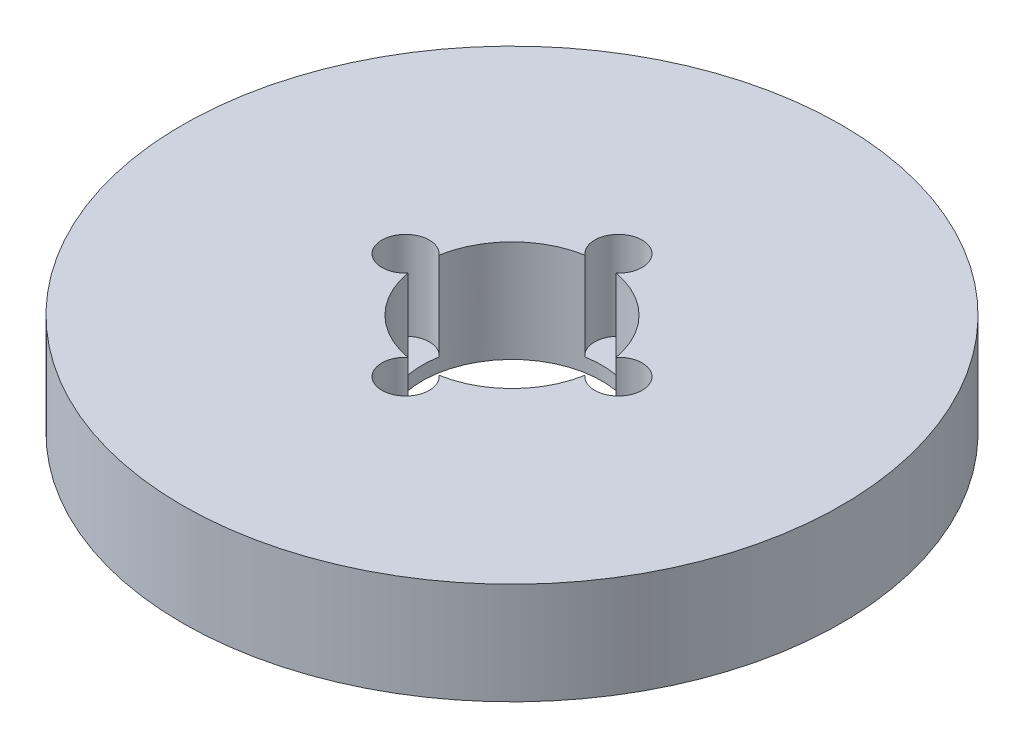
from build123d import *

# Parameters (mm, degrees)
SKETCH1_R           = 55
BOSS_EXTRUDE1_DEPTH = 17
SKETCH2_R           = 15
CUT_EXTRUDE1_DEPTH  = 80.617837197
SKETCH3_R           = 3.964920539
CUT_EXTRUDE2_DEPTH  = 14.720649074
CIRPATTERN1_COUNT   = 4


with BuildPart() as part:
    # Sketch1 → Boss-Extrude1 (new body)
    with BuildSketch(Plane(origin=(0, 0, 0), x_dir=(1, 0, 0), z_dir=(0, 1, 0))):
        Circle(SKETCH1_R)
    extrude(amount=BOSS_EXTRUDE1_DEPTH)

    # Sketch2 → Cut-Extrude1 (cut, through all)
    with BuildSketch(Plane(origin=(0, 0, 0), x_dir=(1, 0, 0), z_dir=(0, 1, 0))):
        Circle(SKETCH2_R)
    extrude(amount=CUT_EXTRUDE1_DEPTH, mode=Mode.SUBTRACT)

    # Sketch3 → Cut-Extrude2 (cut)
    with BuildSketch(Plane(origin=(0, 17, 0), x_dir=(1, 0, 0), z_dir=(0, 1, 0))):
        with Locations((-17.758888816, 0)):
            Circle(SKETCH3_R)
    cut_extrude2 = extrude(amount=-CUT_EXTRUDE2_DEPTH, mode=Mode.SUBTRACT)

    # CirPattern1: Cut-Extrude2 ×4 about axis
    cirpattern1_axis = Axis((0, 0, 0), (0, 1, 0))
    for i in range(1, CIRPATTERN1_COUNT):
        add(cut_extrude2.rotate(cirpattern1_axis, i * 360 / CIRPATTERN1_COUNT), mode=Mode.SUBTRACT)


solid = part.part
